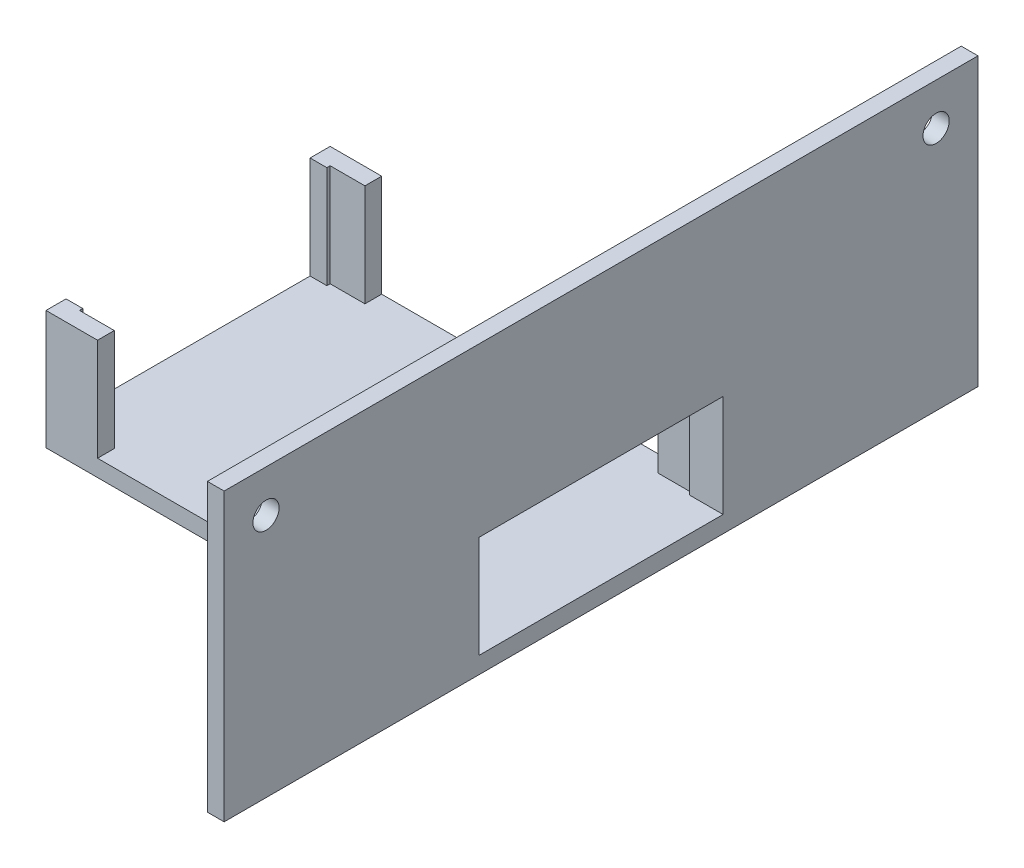
from build123d import *

# Parameters (mm, degrees)
SKETCH1_W               = 60.079999982
SKETCH1_H               = 43.079999946
BOSS_EXTRUDE1_DEPTH     = 18.039999988
SHELL1_T                = -2.54
SKETCH2_W               = 114.3
SKETCH2_H               = 43.439999988
BOSS_EXTRUDE2_DEPTH     = 2.54
FILLET1_R               = 5.08
CUT_EXTRUDE1_DEPTH      = 109.11455079
CUT_EXTRUDE1_DEPTH_BACK = 109.11455079
SKETCH3_R               = 1.984375
SKETCH5_W               = 44.45
SKETCH5_H               = 15.499999988
CUT_EXTRUDE2_DEPTH      = 96.606517007
SKETCH6_W               = 37
SKETCH6_H               = 15.499999988
CUT_EXTRUDE3_DEPTH      = 110.54640155


with BuildPart() as part:
    # Sketch1 → Boss-Extrude1 (new body)
    with BuildSketch(Plane(origin=(0, 0, 0), x_dir=(1, 0, 0), z_dir=(0, 1, 0))):
        with Locations((0, 21.539999973)):
            Rectangle(SKETCH1_W, SKETCH1_H)
    extrude(amount=BOSS_EXTRUDE1_DEPTH)

    # Shell1
    shell1_openings = [part.faces().sort_by_distance(p)[0] for p in [
        (0, 18.039999988, -21.539999973),
    ]]
    offset(amount=SHELL1_T, openings=shell1_openings, kind=Kind.INTERSECTION)

    # Sketch2 → Boss-Extrude2 (add)
    with BuildSketch(Plane(origin=(30.039999991, 0, 0), x_dir=(0, 0, -1), z_dir=(1, 0, 0))):
        with Locations((21.539999973, 21.719999994)):
            Rectangle(SKETCH2_W, SKETCH2_H)
    extrude(amount=BOSS_EXTRUDE2_DEPTH)

    # Fillet1
    # the kernel refuses this fillet: 5.08 mm, written as the material it adds along each edge
    with BuildSketch(Plane(origin=(30.039999991, 18.039999988, -43.079999946), x_dir=(0, 1, 0), z_dir=(0, 0, 1))) as fillet1_piece_1_section:
        with BuildLine():
            CenterArc((FILLET1_R, FILLET1_R), FILLET1_R, 180, 90)
            Line((0, FILLET1_R), (0, 0))
            Line((0, 0), (FILLET1_R, 0))
        make_face()
    fillet1_piece_1 = extrude(amount=43.079999946, mode=Mode.PRIVATE)
    fillet1_piece_1 = split(fillet1_piece_1, bisect_by=Plane(origin=(29.204889828, 19.336009893, -40.539999946), z_dir=(0, 0, -1)), keep=Keep.TOP, mode=Mode.PRIVATE)
    fillet1_piece_1 = split(fillet1_piece_1, bisect_by=Plane(origin=(27.499999991, 19.336009893, -41.809999946), z_dir=(1, 0, 0)), keep=Keep.TOP, mode=Mode.PRIVATE)
    add(fillet1_piece_1)
    with BuildSketch(Plane(origin=(30.039999991, 18.039999988, -43.079999946), x_dir=(0, 1, 0), z_dir=(0, 0, 1))) as fillet1_piece_2_section:
        with BuildLine():
            CenterArc((FILLET1_R, FILLET1_R), FILLET1_R, 180, 90)
            Line((0, FILLET1_R), (0, 0))
            Line((0, 0), (FILLET1_R, 0))
        make_face()
    fillet1_piece_2 = extrude(amount=43.079999946, mode=Mode.PRIVATE)
    fillet1_piece_2 = split(fillet1_piece_2, bisect_by=Plane(origin=(26.670686006, 18.161962567, -40.539999946), z_dir=(0, 0, -1)), keep=Keep.TOP, mode=Mode.PRIVATE)
    fillet1_piece_2 = split(fillet1_piece_2, bisect_by=Plane(origin=(27.499999991, 18.161962567, -41.809999946), z_dir=(-1, 0, 0)), keep=Keep.TOP, mode=Mode.PRIVATE)
    add(fillet1_piece_2)
    with BuildSketch(Plane(origin=(30.039999991, 18.039999988, -43.079999946), x_dir=(0, 1, 0), z_dir=(0, 0, 1))) as fillet1_piece_3_section:
        with BuildLine():
            CenterArc((FILLET1_R, FILLET1_R), FILLET1_R, 180, 90)
            Line((0, FILLET1_R), (0, 0))
            Line((0, 0), (FILLET1_R, 0))
        make_face()
    fillet1_piece_3 = extrude(amount=43.079999946, mode=Mode.PRIVATE)
    fillet1_piece_3 = split(fillet1_piece_3, bisect_by=Plane(origin=(29.204889828, 19.336009893, -40.539999946), z_dir=(0, 0, 1)), keep=Keep.TOP, mode=Mode.PRIVATE)
    fillet1_piece_3 = split(fillet1_piece_3, bisect_by=Plane(origin=(29.204889828, 19.336009893, -2.54), z_dir=(0, 0, -1)), keep=Keep.TOP, mode=Mode.PRIVATE)
    fillet1_piece_3 = split(fillet1_piece_3, bisect_by=Plane(origin=(27.499999991, 19.336009893, -21.539999973), z_dir=(1, 0, 0)), keep=Keep.TOP, mode=Mode.PRIVATE)
    add(fillet1_piece_3)
    with BuildSketch(Plane(origin=(30.039999991, 18.039999988, -43.079999946), x_dir=(0, 1, 0), z_dir=(0, 0, 1))) as fillet1_piece_4_section:
        with BuildLine():
            CenterArc((FILLET1_R, FILLET1_R), FILLET1_R, 180, 90)
            Line((0, FILLET1_R), (0, 0))
            Line((0, 0), (FILLET1_R, 0))
        make_face()
    fillet1_piece_4 = extrude(amount=43.079999946, mode=Mode.PRIVATE)
    fillet1_piece_4 = split(fillet1_piece_4, bisect_by=Plane(origin=(29.204889828, 19.336009893, -2.54), z_dir=(0, 0, 1)), keep=Keep.TOP, mode=Mode.PRIVATE)
    fillet1_piece_4 = split(fillet1_piece_4, bisect_by=Plane(origin=(27.499999991, 19.336009893, -1.27), z_dir=(1, 0, 0)), keep=Keep.TOP, mode=Mode.PRIVATE)
    add(fillet1_piece_4)
    with BuildSketch(Plane(origin=(30.039999991, 18.039999988, -43.079999946), x_dir=(0, 1, 0), z_dir=(0, 0, 1))) as fillet1_piece_5_section:
        with BuildLine():
            CenterArc((FILLET1_R, FILLET1_R), FILLET1_R, 180, 90)
            Line((0, FILLET1_R), (0, 0))
            Line((0, 0), (FILLET1_R, 0))
        make_face()
    fillet1_piece_5 = extrude(amount=43.079999946, mode=Mode.PRIVATE)
    fillet1_piece_5 = split(fillet1_piece_5, bisect_by=Plane(origin=(26.670686006, 18.161962567, -2.54), z_dir=(0, 0, 1)), keep=Keep.TOP, mode=Mode.PRIVATE)
    fillet1_piece_5 = split(fillet1_piece_5, bisect_by=Plane(origin=(27.499999991, 18.161962567, -1.27), z_dir=(-1, 0, 0)), keep=Keep.TOP, mode=Mode.PRIVATE)
    add(fillet1_piece_5)

    # Sketch3 → Cut-Extrude1 (cut, two sides: drawn at the far end of the back side and taken through both)
    with BuildSketch(Plane.ZY.offset(-30.039999991).offset(-CUT_EXTRUDE1_DEPTH_BACK)):
        with Locations((-72.339999973, 37.089999988)):
            Circle(SKETCH3_R)
        with Locations((29.260000027, 37.089999988)):
            Circle(SKETCH3_R)
    extrude(amount=CUT_EXTRUDE1_DEPTH + CUT_EXTRUDE1_DEPTH_BACK, mode=Mode.SUBTRACT)

    # Sketch5 → Cut-Extrude2 (cut, through all)
    with BuildSketch(Plane.XY):
        with Locations((0, 10.289999994)):
            Rectangle(SKETCH5_W, SKETCH5_H)
    extrude(amount=-CUT_EXTRUDE2_DEPTH, mode=Mode.SUBTRACT)

    # Sketch6 → Cut-Extrude3 (cut, through all)
    with BuildSketch(Plane.ZY.offset(30.039999991)):
        with Locations((-21.539999973, 10.289999994)):
            Rectangle(SKETCH6_W, SKETCH6_H)
    extrude(amount=-CUT_EXTRUDE3_DEPTH, mode=Mode.SUBTRACT)


solid = part.part
